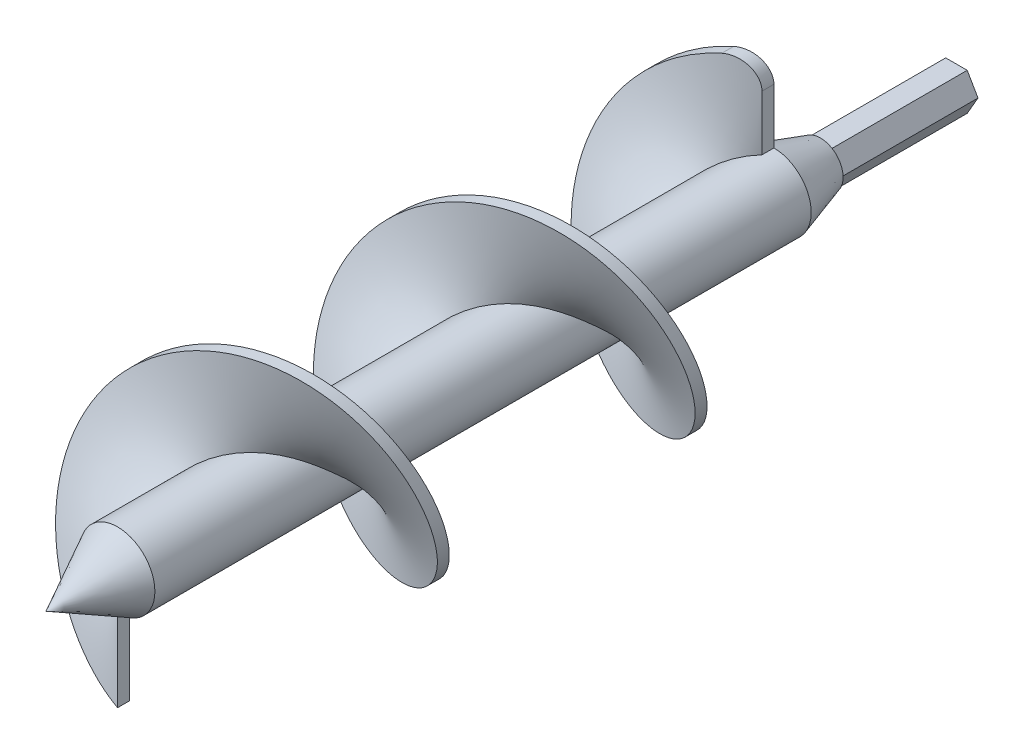
from build123d import *

# Parameters (mm, degrees)
SKETCH6_W           = 7.9375
SKETCH6_H           = 139.7
BOSS_EXTRUDE1_DEPTH = 28.956
SWEEP2_PITCH        = 54.864
SWEEP2_HEIGHT       = 137.16
SWEEP2_RADIUS       = 25.4
SWEEP2_START_ANGLE  = 90
SKETCH14_W          = 17.4625
SKETCH14_H          = 2.54
FILLET2_R           = 5.08


with BuildPart() as part:
    # Sketch6 → Revolve1 (revolve)
    with BuildSketch(Plane.YZ, mode=Mode.PRIVATE) as revolve1_sk:
        with Locations((-3.96875, 69.85)):
            Rectangle(SKETCH6_W, SKETCH6_H)
        Polygon((0, 154.94), (0, 139.7), (-7.9375, 139.7), align=None)
        Polygon((-4.826, -9.906), (-7.9375, 0), (0, 0), (0, -9.906), align=None)
    revolve(revolve1_sk.sketch.rotate(Axis((0, 0, 0), (0, 0, 1)), 180), axis=Axis((0, 0, 0), (0, 0, 1)))

    # Sketch12 → Boss-Extrude1 (add)
    with BuildSketch(Plane(origin=(0, 0, -9.906), x_dir=(1, 0, 0), z_dir=(0, 0, -1))):
        Polygon((4.582717762, 0), (2.291358881, 3.96875), (-2.291358881, 3.96875), (-4.582717762, 0), (-2.291358881, -3.96875), (2.291358881, -3.96875), align=None)
    extrude(amount=BOSS_EXTRUDE1_DEPTH)

    # Sweep2: sweep along a helix
    with BuildLine() as sweep2_path:
        add(Helix(SWEEP2_PITCH, SWEEP2_HEIGHT, SWEEP2_RADIUS, center=(0, 0, 0), direction=(0, 0, 1), mode=Mode.PRIVATE).rotate(Axis((0, 0, 0), (0, 0, 1)), SWEEP2_START_ANGLE))
    # Sketch14 → Sweep2 (sweep)
    with BuildSketch(Plane.YZ):
        with Locations((16.66875, 1.27)):
            Rectangle(SKETCH14_W, SKETCH14_H)
    sweep(path=sweep2_path.line, is_frenet=True)

    # Fillet2
    # the kernel refuses this fillet: 5.08 mm, written as the material it takes off along each edge
    with BuildSketch(Plane(origin=(0, 25.4, -16.002533638), x_dir=(-0.9920296778032264, -0.1260044378489384, -5.373988950581298e-15), z_dir=(0, 0, 1))) as fillet2_piece_1:
        with BuildLine():
            CenterArc((5.760917187, 5.039511561), FILLET2_R, 172.761235511, 104.477457579)
            Line((0.721406424, 5.679614105), (0, 0))
            ThreePointArc((0, 0), (3.200506769, -0.202443746), (6.401013452, 0))
        make_face()
    extrude(amount=34.545067276, mode=Mode.SUBTRACT)


solid = part.part
